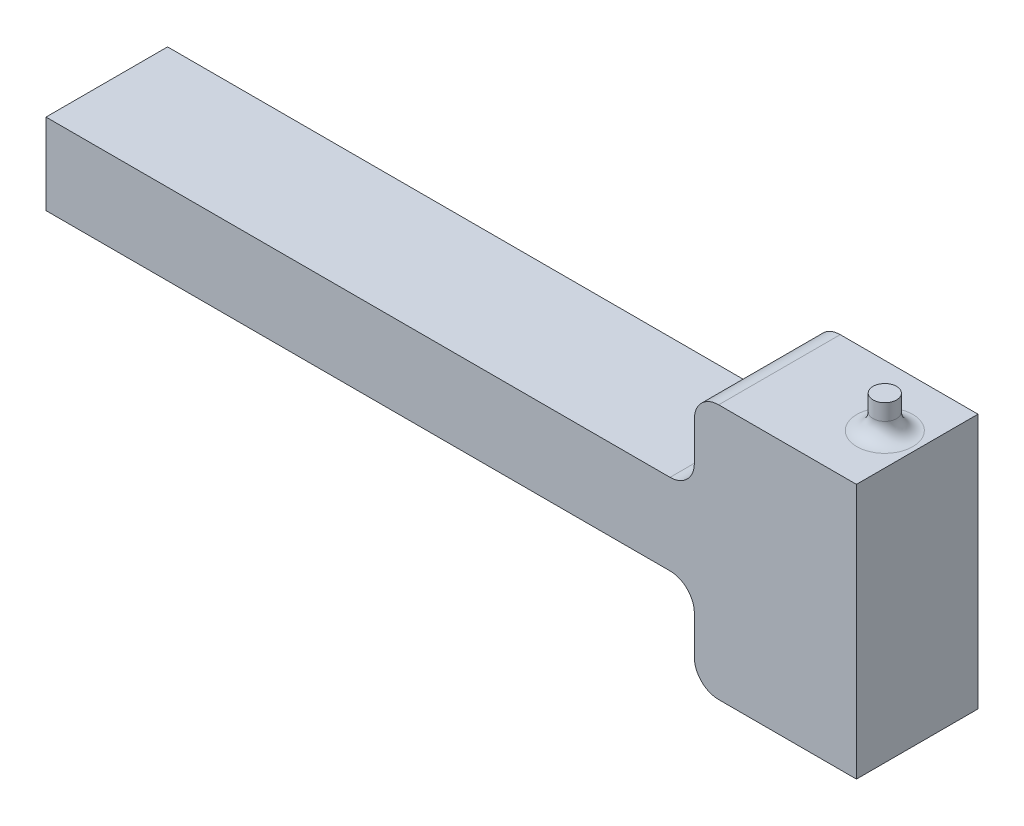
from build123d import *

# Parameters (mm, degrees)
SKETCH2_W               = 100
SKETCH2_H               = 15
BOSS_EXTRUDE2_DEPTH     = 15.75
CUT_EXTRUDE3_DEPTH      = 55.525796647
CUT_EXTRUDE3_DEPTH_BACK = 55.525796647
SKETCH6_W               = 80
SKETCH6_H               = 10.75
FILLET2_R               = 3
SKETCH7_R               = 1.45
BOSS_EXTRUDE3_DEPTH     = 4
FILLET3_R               = 2


with BuildPart() as part:
    # Sketch2 → Boss-Extrude2 (new, symmetric)
    with BuildSketch(Plane(origin=(0, 0, 0), x_dir=(1, 0, 0), z_dir=(0, 1, 0))):
        Rectangle(SKETCH2_W, SKETCH2_H)
    extrude(amount=BOSS_EXTRUDE2_DEPTH, both=True)

    # Sketch6 → Cut-Extrude3 (cut, two sides: drawn at the far end of the back side and taken through both)
    with BuildSketch(Plane.XY.offset(7.5).offset(-CUT_EXTRUDE3_DEPTH_BACK)):
        with Locations((-10, 10.375)):
            Rectangle(SKETCH6_W, SKETCH6_H)
        with Locations((-10, -10.375)):
            Rectangle(SKETCH6_W, SKETCH6_H)
    extrude(amount=CUT_EXTRUDE3_DEPTH + CUT_EXTRUDE3_DEPTH_BACK, mode=Mode.SUBTRACT)

    # Fillet2
    fillet2_edges = [part.edges().sort_by_distance(p)[0] for p in [
        (30, 15.75, 0),
        (30, 5, 0),
        (30, -5, 0),
        (30, -15.75, 0),
    ]]
    fillet(fillet2_edges, radius=FILLET2_R)

    # Sketch7 → Boss-Extrude3 (add)
    with BuildSketch(Plane(origin=(0, 15.75, 0), x_dir=(1, 0, 0), z_dir=(0, 1, 0))):
        with Locations((46, 0)):
            Circle(SKETCH7_R)
    extrude(amount=BOSS_EXTRUDE3_DEPTH)

    # Fillet3
    fillet3_edges = [part.edges().sort_by_distance(p)[0] for p in [
        (44.55, 15.75, 0),
    ]]
    fillet(fillet3_edges, radius=FILLET3_R)


solid = part.part
